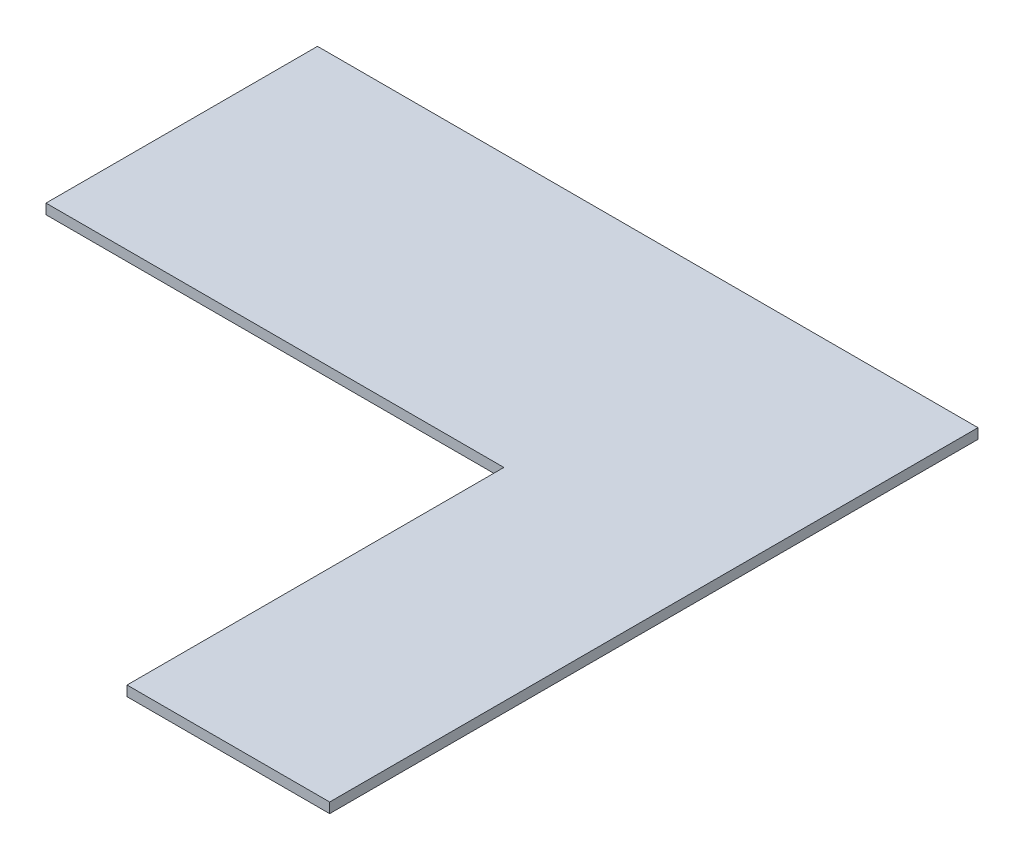
from build123d import *

# Parameters (mm, degrees)
EXTRUDE_1_DEPTH = 25


with BuildPart() as part:
    # Эскиз1 → Бобышка-Вытянуть1 (new body)
    with BuildSketch(Plane(origin=(0, 0, 0), x_dir=(1, 0, 0), z_dir=(0, 1, 0))):
        Polygon((0, 0), (0, 670), (1630, 670), (1630, -930), (1130, -930), (1130, 0), align=None)
    extrude(amount=EXTRUDE_1_DEPTH)


solid = part.part
